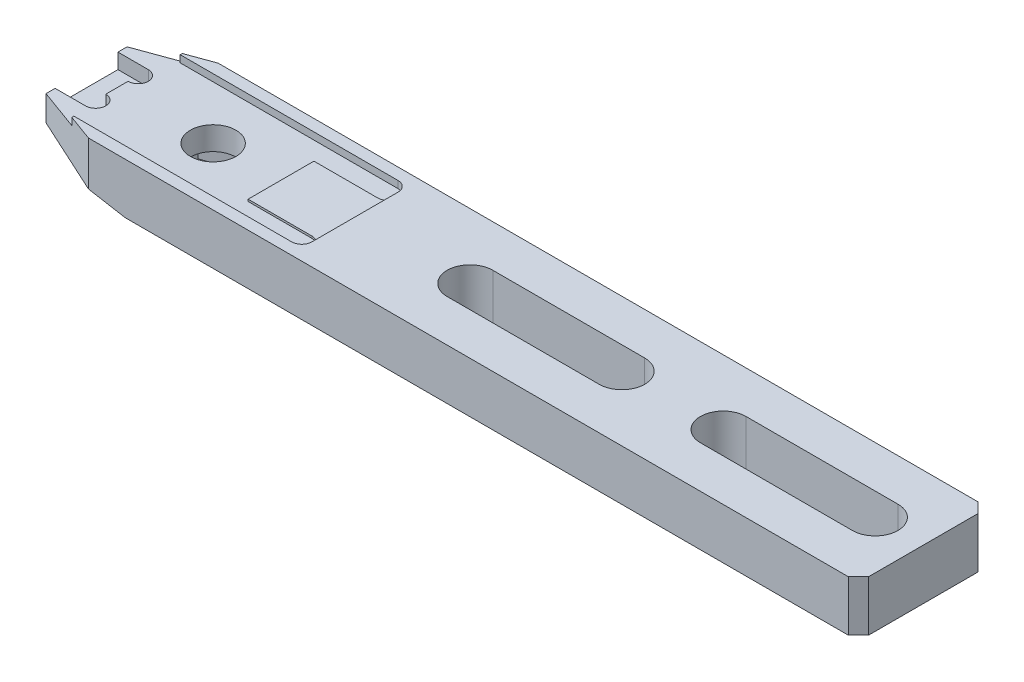
from build123d import *

# Parameters (mm, degrees)
BOSS_EXTRUDE1_DEPTH   = 5
CUT_EXTRUDE1_REACH    = 84.998
CUT_EXTRUDE2_DEPTH    = 9
SKETCH7_W             = 26.5
SKETCH7_H             = 10.5
CUT_EXTRUDE3_DEPTH    = 0.7
CUT_EXTRUDE4_DEPTH    = 1.5
F_4_0MM_DOWEL_HOLE1_D = 4.5
CUT_EXTRUDE6_DEPTH    = 2
CHAMFER1_SIZE         = 1
SKETCH12_W            = 4
SKETCH12_H            = 16
CUT_EXTRUDE5_DEPTH    = 0.7
SKETCH13_W            = 7.3
SKETCH13_H            = 6.5
BOSS_EXTRUDE2_DEPTH   = 0.2
FILLET1_R             = 1


with BuildPart() as part:
    # Sketch1 → Boss-Extrude1 (new body)
    with BuildSketch(Plane(origin=(0, 0, 0), x_dir=(1, 0, 0), z_dir=(0, 1, 0))):
        Polygon((0, -4), (0, 4), (6.593945807, 6.4), (82.6, 6.4), (82.6, -6.4), (6.593945807, -6.4), align=None)
    extrude(amount=-BOSS_EXTRUDE1_DEPTH)

    # Sketch2 → Cut-Extrude1 (cut, up to next)
    with BuildSketch(Plane(origin=(0, 0, 0), x_dir=(1, 0, 0), z_dir=(0, 1, 0)), mode=Mode.PRIVATE) as cut_extrude1_sk1:
        with BuildLine():
            Line((62.85, 2.25), (77.85, 2.25))
            ThreePointArc((77.85, 2.25), (80.1, 0), (77.85, -2.25))
            Line((77.85, -2.25), (62.85, -2.25))
            ThreePointArc((62.85, -2.25), (60.6, 0), (62.85, 2.25))
        make_face()
    cut_extrude1_tool1 = extrude(cut_extrude1_sk1.sketch, amount=-CUT_EXTRUDE1_REACH, mode=Mode.PRIVATE) & part.part
    # Sketch2 → Cut-Extrude1 (cut, up to next)
    with BuildSketch(Plane(origin=(0, 0, 0), x_dir=(1, 0, 0), z_dir=(0, 1, 0)), mode=Mode.PRIVATE) as cut_extrude1_sk2:
        with BuildLine():
            Line((52.85, -2.25), (37.85, -2.25))
            ThreePointArc((37.85, -2.25), (35.6, 0), (37.85, 2.25))
            Line((37.85, 2.25), (52.85, 2.25))
            ThreePointArc((52.85, 2.25), (55.1, 0), (52.85, -2.25))
        make_face()
    cut_extrude1_tool2 = extrude(cut_extrude1_sk2.sketch, amount=-CUT_EXTRUDE1_REACH, mode=Mode.PRIVATE) & part.part
    add(cut_extrude1_tool1.solids().sort_by_distance((70.35, 0, 0))[0], mode=Mode.SUBTRACT)
    add(cut_extrude1_tool2.solids().sort_by_distance((45.35, 0, 0))[0], mode=Mode.SUBTRACT)

    # Sketch6 → Cut-Extrude2 (cut, symmetric)
    with BuildSketch(Plane.XY):
        Polygon((0, -3.2), (10.208307275, -5), (0, -5), align=None)
    extrude(amount=CUT_EXTRUDE2_DEPTH, both=True, mode=Mode.SUBTRACT)

    # Sketch7 → Cut-Extrude3 (cut)
    with BuildSketch(Plane(origin=(0, 0, 0), x_dir=(1, 0, 0), z_dir=(0, 1, 0))):
        with Locations((13.25, 0)):
            Rectangle(SKETCH7_W, SKETCH7_H)
    extrude(amount=-CUT_EXTRUDE3_DEPTH, mode=Mode.SUBTRACT)

    # Sketch8 → Cut-Extrude4 (cut)
    with BuildSketch(Plane(origin=(0, -0.7, 0), x_dir=(1, 0, 0), z_dir=(0, 1, 0))):
        with BuildLine():
            Line((0, -3.1), (0, 3.1))
            Line((0, 3.1), (3, 3.1))
            ThreePointArc((3, 3.1), (4, 2.1), (3, 1.1))
            Line((3, 1.1), (3, 0))
            Line((3, 0), (3, -1.1))
            ThreePointArc((3, -1.1), (4, -2.1), (3, -3.1))
            Line((3, -3.1), (0, -3.1))
        make_face()
    extrude(amount=-CUT_EXTRUDE4_DEPTH, mode=Mode.SUBTRACT)

    # Ø4.0mm Dowel Hole1 (through all)
    with Locations(Plane(origin=(0, -0.7, 0), x_dir=(1, 0, 0), z_dir=(0, 1, 0))):
        with Locations((12.5, 0)):
            Hole(F_4_0MM_DOWEL_HOLE1_D / 2)

    # Sketch14 → Cut-Extrude6 (cut)
    with BuildSketch(Plane.XZ.offset(5)):
        Polygon((16, -2.020725942), (16, 2.020725942), (12.5, 4.041451884), (9, 2.020725942), (9, -2.020725942), (12.5, -4.041451884), align=None)
    extrude(amount=-CUT_EXTRUDE6_DEPTH, mode=Mode.SUBTRACT)

    # Chamfer1
    chamfer1_edges = [part.edges().sort_by_distance(p)[0] for p in [
        (82.6, -2.5, -6.4),
        (82.6, -2.5, 6.4),
    ]]
    chamfer(chamfer1_edges, length=CHAMFER1_SIZE)

    # Sketch12 → Cut-Extrude5 (cut)
    with BuildSketch(Plane(origin=(0, 0, 0), x_dir=(1, 0, 0), z_dir=(0, 1, 0))):
        with Locations((2, 0)):
            Rectangle(SKETCH12_W, SKETCH12_H)
    extrude(amount=-CUT_EXTRUDE5_DEPTH, mode=Mode.SUBTRACT)

    # Sketch13 → Boss-Extrude2 (add)
    with BuildSketch(Plane(origin=(0, -0.7, 0), x_dir=(1, 0, 0), z_dir=(0, 1, 0))):
        with Locations((22.85, 0)):
            Rectangle(SKETCH13_W, SKETCH13_H)
    extrude(amount=BOSS_EXTRUDE2_DEPTH)

    # Fillet1
    fillet1_edges = [part.edges().sort_by_distance(p)[0] for p in [
        (26.5, -0.35, 5.25),
        (26.5, -0.6, 3.25),
        (26.5, -0.6, -3.25),
        (26.5, -0.35, -5.25),
    ]]
    fillet(fillet1_edges, radius=FILLET1_R - 0.0001)  # a hair under: the kernel refuses the full size


solid = part.part
